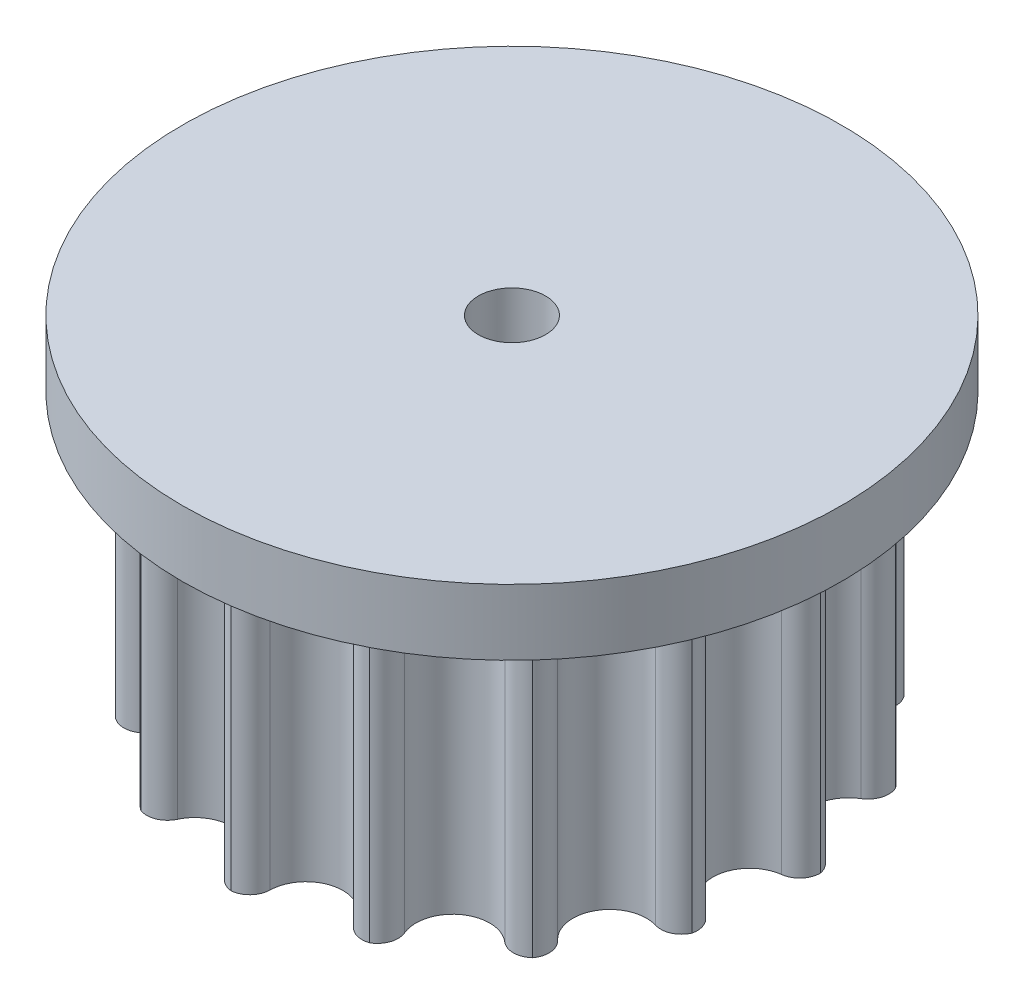
from build123d import *

# Parameters (mm, degrees)
BOSS_EXTRUDE1_DEPTH     = 3.556
CIRPATTERN1_COUNT       = 15
SKETCH2_W               = 7.954934775
SKETCH2_H               = 1.5875
CUT_EXTRUDE1_DEPTH      = 13.346846992
CUT_EXTRUDE1_DEPTH_BACK = 13.346846992
SKETCH3_R               = 0.811184775


with BuildPart() as part:
    # Sketch1 → Boss-Extrude1 (new, symmetric)
    with BuildSketch(Plane(origin=(0, 0, 0), x_dir=(1, 0, 0), z_dir=(0, 1, 0))):
        with BuildLine():
            ThreePointArc((0.866466766, 6.246873729), (0.552789859, 5.752672402), (0, 5.560184675))
            ThreePointArc((0, 5.560184675), (-1.156027397, -5.438681299), (2.261530849, 5.079481453))
            ThreePointArc((2.261530849, 5.079481453), (1.834823997, 5.480167634), (1.749275672, 6.059226903))
            ThreePointArc((1.749275672, 6.059226903), (1.687548707, 6.408986287), (1.409147818, 6.629519254))
            ThreePointArc((1.409147818, 6.629519254), (1.065117112, 6.541288206), (0.866466766, 6.246873729))
        make_face()
    boss_extrude1 = extrude(amount=BOSS_EXTRUDE1_DEPTH, both=True)

    # CirPattern1: Boss-Extrude1 ×15 about axis
    cirpattern1_axis = Axis((0, 3.3, 0), (0, -1, 0))
    for i in range(1, CIRPATTERN1_COUNT):
        add(boss_extrude1.rotate(cirpattern1_axis, i * 360 / CIRPATTERN1_COUNT))

    # Sketch2 → Revolve3 (revolve)
    with BuildSketch(Plane(origin=(0, 0, 0), x_dir=(0, 0, -1), z_dir=(1, 0, 0))):
        with Locations((3.977467388, 4.293749985)):
            Rectangle(SKETCH2_W, SKETCH2_H)
    revolve(axis=Axis((0, 3.3, 0), (0, -1, 0)))

    # Sketch3 → Cut-Extrude1 (cut, two sides: drawn at the far end of the back side and taken through both)
    with BuildSketch(Plane(origin=(0, 0, 0), x_dir=(-1, 0, 0), z_dir=(0, -1, 0)).offset(-CUT_EXTRUDE1_DEPTH_BACK)):
        Circle(SKETCH3_R)
    extrude(amount=CUT_EXTRUDE1_DEPTH + CUT_EXTRUDE1_DEPTH_BACK, mode=Mode.SUBTRACT)


solid = part.part
